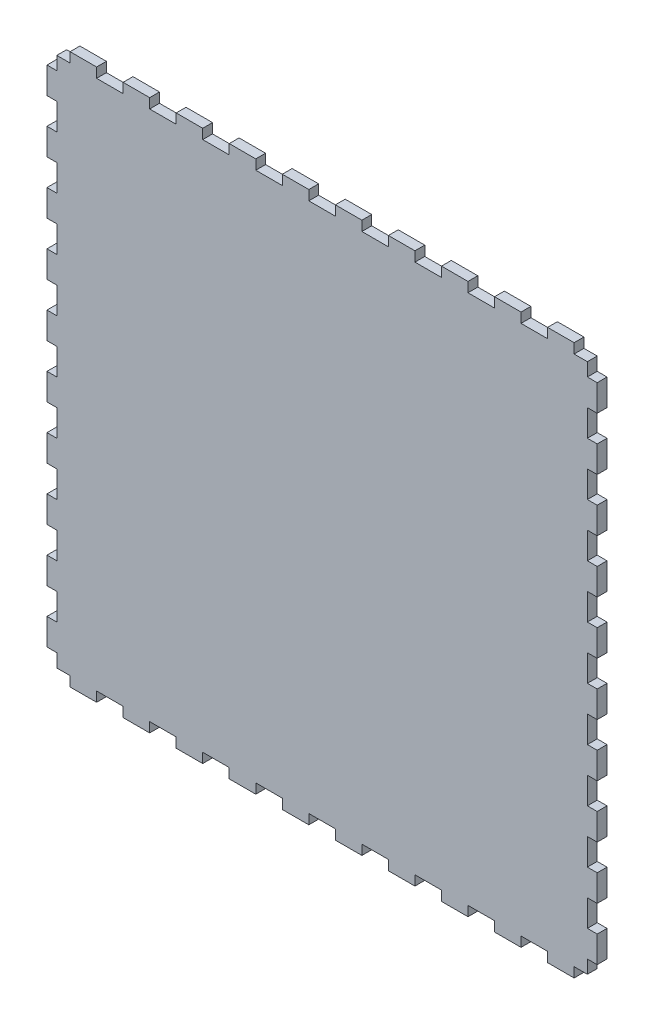
from build123d import *

# Parameters (mm, degrees)
BOSS_EXTRUDE1_DEPTH = 6.35


with BuildPart() as part:
    # Sketch1 → Boss-Extrude1 (new body)
    with BuildSketch(Plane.XY):
        Polygon((14.9225, 349.25), (6.35, 349.25), (6.35, 340.6775), (0, 340.6775), (0, 323.5325), (6.35, 323.5325), (6.35, 306.3875), (0, 306.3875), (0, 289.2425), (6.35, 289.2425), (6.35, 272.0975), (0, 272.0975), (0, 254.9525), (6.35, 254.9525), (6.35, 237.8075), (0, 237.8075), (0, 220.6625), (6.35, 220.6625), (6.35, 203.5175), (0, 203.5175), (0, 186.3725), (6.35, 186.3725), (6.35, 169.2275), (0, 169.2275), (0, 152.0825), (6.35, 152.0825), (6.35, 134.9375), (0, 134.9375), (0, 117.7925), (6.35, 117.7925), (6.35, 100.6475), (0, 100.6475), (0, 83.5025), (6.35, 83.5025), (6.35, 66.3575), (0, 66.3575), (0, 49.2125), (6.35, 49.2125), (6.35, 32.0675), (0, 32.0675), (0, 14.9225), (6.35, 14.9225), (6.35, 6.35), (14.9225, 6.35), (14.9225, 0), (32.0675, 0), (32.0675, 6.35), (49.2125, 6.35), (49.2125, 0), (66.3575, 0), (66.3575, 6.35), (83.5025, 6.35), (83.5025, 0), (100.6475, 0), (100.6475, 6.35), (117.7925, 6.35), (117.7925, 0), (134.9375, 0), (134.9375, 6.35), (152.0825, 6.35), (152.0825, 0), (169.2275, 0), (169.2275, 6.35), (186.3725, 6.35), (186.3725, 0), (203.5175, 0), (203.5175, 6.35), (220.6625, 6.35), (220.6625, 0), (237.8075, 0), (237.8075, 6.35), (254.9525, 6.35), (254.9525, 0), (272.0975, 0), (272.0975, 6.35), (289.2425, 6.35), (289.2425, 0), (306.3875, 0), (306.3875, 6.35), (323.5325, 6.35), (323.5325, 0), (340.6775, 0), (340.6775, 6.35), (349.25, 6.35), (349.25, 14.9225), (355.6, 14.9225), (355.6, 32.0675), (349.25, 32.0675), (349.25, 49.2125), (355.6, 49.2125), (355.6, 66.3575), (349.25, 66.3575), (349.25, 83.5025), (355.6, 83.5025), (355.6, 100.6475), (349.25, 100.6475), (349.25, 117.7925), (355.6, 117.7925), (355.6, 134.9375), (349.25, 134.9375), (349.25, 152.0825), (355.6, 152.0825), (355.6, 169.2275), (349.25, 169.2275), (349.25, 186.3725), (355.6, 186.3725), (355.6, 203.5175), (349.25, 203.5175), (349.25, 220.6625), (355.6, 220.6625), (355.6, 237.8075), (349.25, 237.8075), (349.25, 254.9525), (355.6, 254.9525), (355.6, 272.0975), (349.25, 272.0975), (349.25, 289.2425), (355.6, 289.2425), (355.6, 306.3875), (349.25, 306.3875), (349.25, 323.5325), (355.6, 323.5325), (355.6, 340.6775), (349.25, 340.6775), (349.25, 349.25), (340.6775, 349.25), (340.6775, 355.6), (323.5325, 355.6), (323.5325, 349.25), (306.3875, 349.25), (306.3875, 355.6), (289.2425, 355.6), (289.2425, 349.25), (272.0975, 349.25), (272.0975, 355.6), (254.9525, 355.6), (254.9525, 349.25), (237.8075, 349.25), (237.8075, 355.6), (220.6625, 355.6), (220.6625, 349.25), (203.5175, 349.25), (203.5175, 355.6), (186.3725, 355.6), (186.3725, 349.25), (169.2275, 349.25), (169.2275, 355.6), (152.0825, 355.6), (152.0825, 349.25), (134.9375, 349.25), (134.9375, 355.6), (117.7925, 355.6), (117.7925, 349.25), (100.6475, 349.25), (100.6475, 355.6), (83.5025, 355.6), (83.5025, 349.25), (66.3575, 349.25), (66.3575, 355.6), (49.2125, 355.6), (49.2125, 349.25), (32.0675, 349.25), (32.0675, 355.6), (14.9225, 355.6), align=None)
    extrude(amount=BOSS_EXTRUDE1_DEPTH)


solid = part.part
